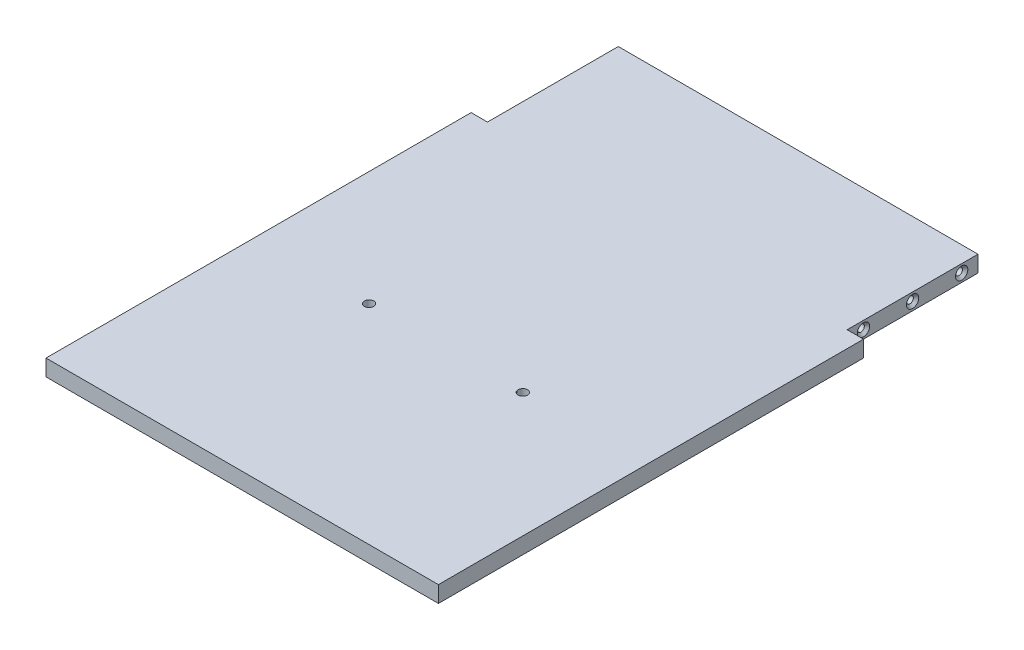
from build123d import *

# Parameters (mm, degrees)
BOSS_EXTRUDE1_DEPTH             = 6.35
F_6_32_TAPPED_HOLE1_D           = 2.7051
F_6_32_TAPPED_HOLE1_DEPTH       = 11.88730597
F_6_32_TAPPED_HOLE1_CSINK_D     = 4.7752
F_6_32_TAPPED_HOLE1_CSINK_ANGLE = 90
F_6_32_TAPPED_HOLE1_TIP         = 0.81269403
F_6_32_TAPPED_HOLE2_D           = 2.7051
F_6_32_TAPPED_HOLE2_DEPTH       = 11.88730597
F_6_32_TAPPED_HOLE2_CSINK_D     = 4.7752
F_6_32_TAPPED_HOLE2_CSINK_ANGLE = 90
F_6_32_TAPPED_HOLE2_TIP         = 0.81269403
SKETCH8_R                       = 1.8288
CUT_EXTRUDE1_DEPTH              = 265.346160366


with BuildPart() as part:
    # Sketch1 → Boss-Extrude1 (new body)
    with BuildSketch(Plane(origin=(0, 0, 0), x_dir=(1, 0, 0), z_dir=(0, 1, 0))):
        Polygon((-6.35, 0), (-6.35, -50.8), (0, -50.8), (0, -215.9), (-152.4, -215.9), (-152.4, -50.8), (-146.05, -50.8), (-146.05, 0), align=None)
    extrude(amount=BOSS_EXTRUDE1_DEPTH)

    # #6-32 Tapped Hole1
    with Locations(Plane(origin=(-6.35, 0, 0), x_dir=(0, 0, -1), z_dir=(1, 0, 0))):
        with Locations((-44.45, 3.175), (-25.4, 3.175), (-6.35, 3.175)):
            CounterSinkHole(F_6_32_TAPPED_HOLE1_D / 2, F_6_32_TAPPED_HOLE1_CSINK_D / 2, depth=F_6_32_TAPPED_HOLE1_DEPTH, counter_sink_angle=F_6_32_TAPPED_HOLE1_CSINK_ANGLE)
            with Locations((0, 0, -(F_6_32_TAPPED_HOLE1_DEPTH + F_6_32_TAPPED_HOLE1_TIP / 2))):  # 118° drill point
                Cone(0, F_6_32_TAPPED_HOLE1_D / 2, F_6_32_TAPPED_HOLE1_TIP, mode=Mode.SUBTRACT)

    # #6-32 Tapped Hole2
    with Locations(Plane.ZY.offset(146.05)):
        with Locations((6.35, 3.175), (25.4, 3.175), (44.45, 3.175)):
            CounterSinkHole(F_6_32_TAPPED_HOLE2_D / 2, F_6_32_TAPPED_HOLE2_CSINK_D / 2, depth=F_6_32_TAPPED_HOLE2_DEPTH, counter_sink_angle=F_6_32_TAPPED_HOLE2_CSINK_ANGLE)
            with Locations((0, 0, -(F_6_32_TAPPED_HOLE2_DEPTH + F_6_32_TAPPED_HOLE2_TIP / 2))):  # 118° drill point
                Cone(0, F_6_32_TAPPED_HOLE2_D / 2, F_6_32_TAPPED_HOLE2_TIP, mode=Mode.SUBTRACT)

    # Sketch8 → Cut-Extrude1 (cut, through all)
    with BuildSketch(Plane(origin=(0, 6.35, 0), x_dir=(1, 0, 0), z_dir=(0, 1, 0))):
        with Locations((-48.26, -134.874)):
            Circle(SKETCH8_R)
        with Locations((-107.95, -134.874)):
            Circle(SKETCH8_R)
    extrude(amount=-CUT_EXTRUDE1_DEPTH, mode=Mode.SUBTRACT)


solid = part.part
